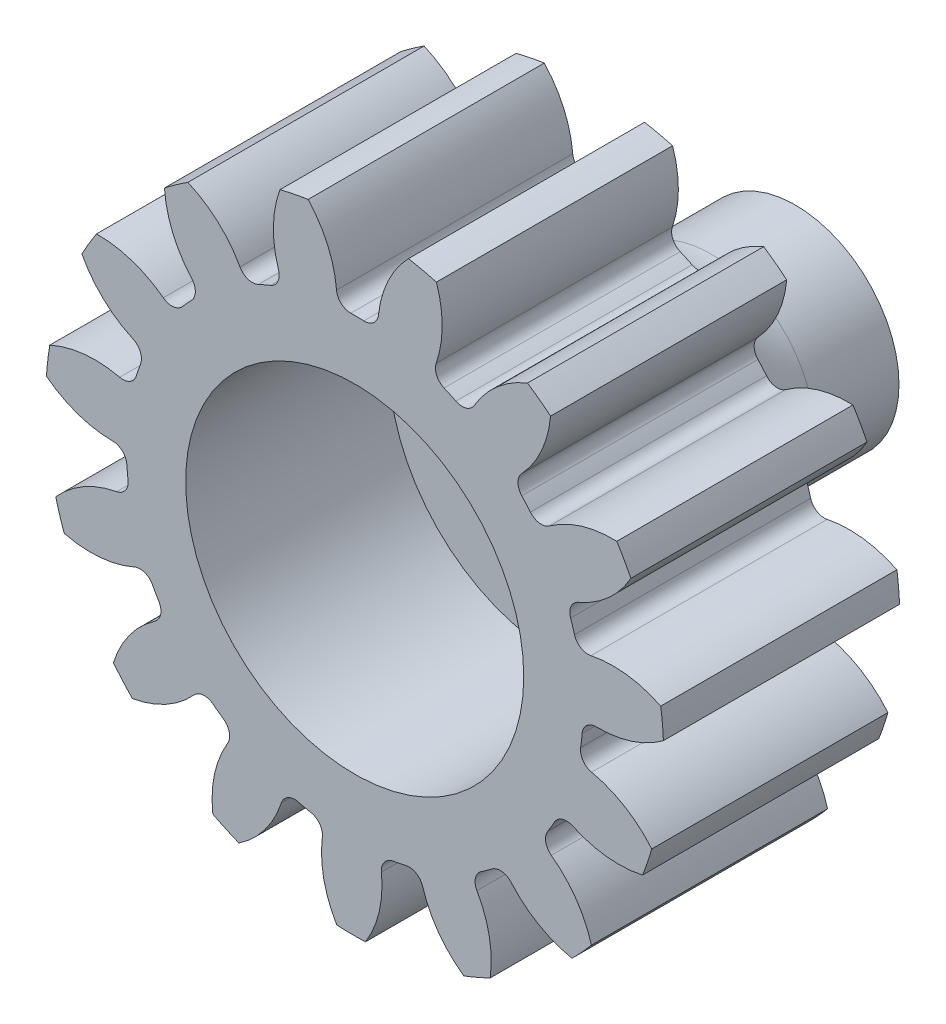
from build123d import *

# Parameters (mm, degrees)
SKETCH3_R          = 21.59
GEARBODY_DEPTH     = 11
TOOTHCUT_DEPTH     = 33.453908855
CIRPATTERN1_COUNT  = 15
SCALE1_SCALE_X     = 0.666666667
SCALE1_SCALE_Y     = 0.666666667
SCALE1_SCALE_Z     = 1
BOREDIA_R          = 7.874
BORE_DEPTH         = 12700
SKETCH5_R          = 2.65
CUT_EXTRUDE1_DEPTH = 3.745992
CUT_EXTRUDE4_DEPTH = 3.745992
CIRPATTERN2_COUNT  = 25


with BuildPart() as part:
    # Sketch3 → gearBody (new body)
    with BuildSketch(Plane.XY):
        Circle(SKETCH3_R)
    extrude(amount=GEARBODY_DEPTH)

    # Sketch2 → toothCut (cut, through all)
    with BuildSketch(Plane.XY):
        with BuildLine():
            ThreePointArc((15.783846764, -2.304552616), (15.843293638, -1.852249483), (15.889781974, -1.39843136))
            ThreePointArc((15.889781974, -1.39843136), (16.213055843, -0.751556907), (16.890861518, -0.499501321))
            ThreePointArc((16.890861518, -0.499501321), (20.504912911, 0.340315353), (23.283949955, 2.798691365))
            ThreePointArc((23.283949955, 2.798691365), (23.292901215, -2.723187818), (22.010467945, -8.09409042))
            ThreePointArc((22.010467945, -8.09409042), (19.873444675, -5.060974685), (16.550574786, -3.410158156))
            ThreePointArc((16.550574786, -3.410158156), (15.949189176, -3.008551507), (15.783846764, -2.304552616))
        make_face()
    toothcut = extrude(amount=TOOTHCUT_DEPTH, mode=Mode.SUBTRACT)

    # CirPattern1: toothCut ×15 about axis
    cirpattern1_axis = Axis((0, 0, 11), (0, 0, -1))
    for i in range(1, CIRPATTERN1_COUNT):
        add(toothcut.rotate(cirpattern1_axis, i * 360 / CIRPATTERN1_COUNT), mode=Mode.SUBTRACT)


with BuildPart() as part_1:
    # Scale1: scaled about (0, 0, 5.5)
    add(part.part.scale((SCALE1_SCALE_X, SCALE1_SCALE_Y, SCALE1_SCALE_Z), about=(0, 0, 5.5)))

    # boreDia → bore (cut, symmetric)
    with BuildSketch(Plane.XY):
        Circle(BOREDIA_R)
    extrude(amount=BORE_DEPTH, both=True, mode=Mode.SUBTRACT)

    # Sketch4 → Revolve1 (revolve)
    with BuildSketch(Plane(origin=(0, 0, 0), x_dir=(0, 0, -1), z_dir=(1, 0, 0))):
        with BuildLine():
            Line((9.525, 0), (-1.524, 0))
            Line((-1.524, 0), (-1.524, 7.874))
            Line((-1.524, 7.874), (0, 7.874))
            Line((0, 7.874), (0, 10.414))
            ThreePointArc((0, 10.414), (1.636687307, 6.462687307), (5.588, 4.826))
            Line((5.588, 4.826), (9.525, 4.826))
            Line((9.525, 4.826), (9.525, 0))
        make_face()
    revolve(axis=Axis((0, 0, 0), (0, 0, -1)))

    # Sketch5 → Cut-Extrude1 (cut)
    with BuildSketch(Plane(origin=(0, 0, -9.525), x_dir=(-1, 0, 0), z_dir=(0, 0, -1))):
        Circle(SKETCH5_R)
    extrude(amount=-CUT_EXTRUDE1_DEPTH, mode=Mode.SUBTRACT)

    # Sketch6 → Cut-Extrude4 (cut)
    with BuildSketch(Plane(origin=(0, 0, -9.525), x_dir=(-1, 0, 0), z_dir=(0, 0, -1))):
        with BuildLine():
            Line((0.06, 3.049409779), (0.23, 2.64))
            ThreePointArc((0.23, 2.64), (0, 2.65), (-0.23, 2.64))
            Line((-0.23, 2.64), (-0.06, 3.049409779))
            ThreePointArc((-0.06, 3.049409779), (0, 3.05), (0.06, 3.049409779))
        make_face()
    cut_extrude4 = extrude(amount=-CUT_EXTRUDE4_DEPTH, mode=Mode.SUBTRACT)

    # CirPattern2: Cut-Extrude4 ×25 about axis
    cirpattern2_axis = Axis((0, 0, -5.779008), (0, 0, -1))
    for i in range(1, CIRPATTERN2_COUNT):
        add(cut_extrude4.rotate(cirpattern2_axis, i * 360 / CIRPATTERN2_COUNT), mode=Mode.SUBTRACT)


solid = part_1.part
